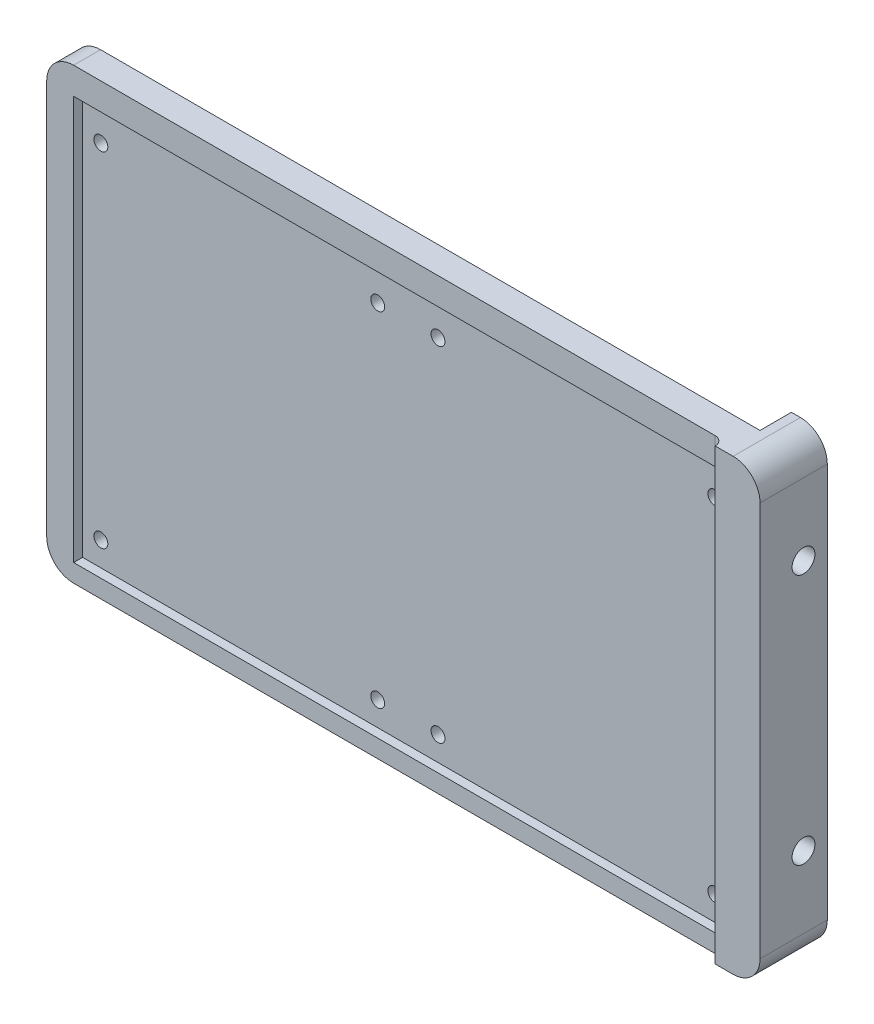
from build123d import *

# Parameters (mm, degrees)
SKETCH1_W                       = 5.3
SKETCH1_H                       = 76.6
SKETCH1_H_2                     = 9.4
SKETCH1_H_3                     = 14
BOSS_EXTRUDE1_DEPTH             = 4
BOSS_EXTRUDE2_DEPTH             = 100
BOSS_EXTRUDE3_REACH             = 186.786
BOSS_EXTRUDE3_DIRECTION_2_REACH = 186.786
FILLET1_R                       = 6
CHAMFER1_SIZE                   = 2
CUT_EXTRUDE1_START              = -4
CUT_EXTRUDE1_DEPTH              = 4
BOSS_EXTRUDE4_DEPTH             = 2
FILLET3_R                       = 2
CUT_EXTRUDE2_START              = -10
CUT_EXTRUDE2_DEPTH              = 10
FILLET4_R                       = 2
FILLET5_R                       = 2


# Some blends are built 0.0001 mm under size
with BuildPart() as part:
    # Sketch1 → Boss-Extrude1 (new body)
    with BuildSketch(Plane.XY):
        with BuildLine():
            Line((0, 100), (0, 0))
            Line((0, 0), (4.07, 0))
            Line((4.07, 0), (4.07, 7.85))
            ThreePointArc((4.07, 7.85), (2.52, 9.4), (4.07, 10.95))
            Line((4.07, 10.95), (4.07, 84.45))
            ThreePointArc((4.07, 84.45), (2.52, 86), (4.07, 87.55))
            Line((4.07, 87.55), (4.07, 100))
            Line((4.07, 100), (0, 100))
        make_face()
        with BuildLine():
            Line((65.78, 100), (4.07, 100))
            Line((4.07, 100), (4.07, 87.55))
            ThreePointArc((4.07, 87.55), (5.166015511, 87.096015511), (5.62, 86))
            Line((5.62, 86), (64.23, 86))
            ThreePointArc((64.23, 86), (64.683984489, 87.096015511), (65.78, 87.55))
            Line((65.78, 87.55), (65.78, 100))
        make_face()
        with BuildLine():
            Line((4.07, 84.45), (4.07, 10.95))
            ThreePointArc((4.07, 10.95), (5.166015511, 10.496015511), (5.62, 9.4))
            Line((5.62, 9.4), (64.23, 9.4))
            ThreePointArc((64.23, 9.4), (64.683984489, 10.496015511), (65.78, 10.95))
            Line((65.78, 10.95), (65.78, 84.45))
            ThreePointArc((65.78, 84.45), (64.683984489, 84.903984489), (64.23, 86))
            Line((64.23, 86), (5.62, 86))
            ThreePointArc((5.62, 86), (5.166015511, 84.903984489), (4.07, 84.45))
        make_face()
        with BuildLine():
            Line((4.07, 7.85), (4.07, 0))
            Line((4.07, 0), (65.78, 0))
            Line((65.78, 0), (65.78, 7.85))
            ThreePointArc((65.78, 7.85), (64.683984489, 8.303984489), (64.23, 9.4))
            Line((64.23, 9.4), (5.62, 9.4))
            ThreePointArc((5.62, 9.4), (5.166015511, 8.303984489), (4.07, 7.85))
        make_face()
        with BuildLine():
            Line((67.33, 9.4), (69.85, 9.4))
            Line((69.85, 9.4), (69.85, 86))
            Line((69.85, 86), (67.33, 86))
            ThreePointArc((67.33, 86), (66.876015511, 84.903984489), (65.78, 84.45))
            Line((65.78, 84.45), (65.78, 10.95))
            ThreePointArc((65.78, 10.95), (66.876015511, 10.496015511), (67.33, 9.4))
        make_face()
        with Locations((72.5, 47.7)):
            Rectangle(SKETCH1_W, SKETCH1_H)
        with BuildLine():
            Line((75.15, 86), (75.15, 9.4))
            Line((75.15, 9.4), (77.67, 9.4))
            ThreePointArc((77.67, 9.4), (78.123984489, 10.496015511), (79.22, 10.95))
            Line((79.22, 10.95), (79.22, 84.45))
            ThreePointArc((79.22, 84.45), (78.123984489, 84.903984489), (77.67, 86))
            Line((77.67, 86), (75.15, 86))
        make_face()
        with BuildLine():
            Line((65.78, 7.85), (65.78, 0))
            Line((65.78, 0), (69.85, 0))
            Line((69.85, 0), (69.85, 9.4))
            Line((69.85, 9.4), (67.33, 9.4))
            ThreePointArc((67.33, 9.4), (66.876015511, 8.303984489), (65.78, 7.85))
        make_face()
        with Locations((72.5, 4.7)):
            Rectangle(SKETCH1_W, SKETCH1_H_2)
        with BuildLine():
            Line((75.15, 9.4), (75.15, 0))
            Line((75.15, 0), (79.22, 0))
            Line((79.22, 0), (79.22, 7.85))
            ThreePointArc((79.22, 7.85), (78.123984489, 8.303984489), (77.67, 9.4))
            Line((77.67, 9.4), (75.15, 9.4))
        make_face()
        with BuildLine():
            Line((69.85, 100), (65.78, 100))
            Line((65.78, 100), (65.78, 87.55))
            ThreePointArc((65.78, 87.55), (66.876015511, 87.096015511), (67.33, 86))
            Line((67.33, 86), (69.85, 86))
            Line((69.85, 86), (69.85, 100))
        make_face()
        with Locations((72.5, 93)):
            Rectangle(SKETCH1_W, SKETCH1_H_3)
        with BuildLine():
            Line((79.22, 100), (75.15, 100))
            Line((75.15, 100), (75.15, 86))
            Line((75.15, 86), (77.67, 86))
            ThreePointArc((77.67, 86), (78.123984489, 87.096015511), (79.22, 87.55))
            Line((79.22, 87.55), (79.22, 100))
        make_face()
        with BuildLine():
            Line((140.93, 100), (79.22, 100))
            Line((79.22, 100), (79.22, 87.55))
            ThreePointArc((79.22, 87.55), (80.316015511, 87.096015511), (80.77, 86))
            Line((80.77, 86), (139.38, 86))
            ThreePointArc((139.38, 86), (139.833984489, 87.096015511), (140.93, 87.55))
            Line((140.93, 87.55), (140.93, 100))
        make_face()
        with BuildLine():
            ThreePointArc((79.22, 10.95), (80.316015511, 10.496015511), (80.77, 9.4))
            Line((80.77, 9.4), (139.38, 9.4))
            ThreePointArc((139.38, 9.4), (139.833984489, 10.496015511), (140.93, 10.95))
            Line((140.93, 10.95), (140.93, 84.45))
            ThreePointArc((140.93, 84.45), (139.833984489, 84.903984489), (139.38, 86))
            Line((139.38, 86), (80.77, 86))
            ThreePointArc((80.77, 86), (80.316015511, 84.903984489), (79.22, 84.45))
            Line((79.22, 84.45), (79.22, 10.95))
        make_face()
        with BuildLine():
            Line((140.93, 7.85), (140.93, 0))
            Line((140.93, 0), (145, 0))
            Line((145, 0), (145, 100))
            Line((145, 100), (140.93, 100))
            Line((140.93, 100), (140.93, 87.55))
            ThreePointArc((140.93, 87.55), (142.026015511, 87.096015511), (142.48, 86))
            ThreePointArc((142.48, 86), (142.026015511, 84.903984489), (140.93, 84.45))
            Line((140.93, 84.45), (140.93, 10.95))
            ThreePointArc((140.93, 10.95), (142.026015511, 10.496015511), (142.48, 9.4))
            ThreePointArc((142.48, 9.4), (142.026015511, 8.303984489), (140.93, 7.85))
        make_face()
        with BuildLine():
            Line((79.22, 7.85), (79.22, 0))
            Line((79.22, 0), (140.93, 0))
            Line((140.93, 0), (140.93, 7.85))
            ThreePointArc((140.93, 7.85), (139.833984489, 8.303984489), (139.38, 9.4))
            Line((139.38, 9.4), (80.77, 9.4))
            ThreePointArc((80.77, 9.4), (80.316015511, 8.303984489), (79.22, 7.85))
        make_face()
    extrude(amount=BOSS_EXTRUDE1_DEPTH)

    # Sketch2 → Boss-Extrude2 (add)
    with BuildSketch(Plane(origin=(0, 100, 0), x_dir=(1, 0, 0), z_dir=(0, 1, 0))):
        Polygon((145, 7), (145, 0), (145, -4), (145, -10), (155, -10), (155, 7), align=None)
    extrude(amount=-BOSS_EXTRUDE2_DEPTH)

    # Boss-Extrude3: up to this face of the body (flat: up to its plane)
    boss_extrude3_end = Plane(part.part.faces().sort_by_distance((150, 50, 10))[0])
    # Sketch3 → Boss-Extrude3 (add, up to the picked face)
    with BuildSketch(Plane.XY.offset(4), mode=Mode.PRIVATE) as boss_extrude3_sk1:
        Polygon((145, 100), (145, 94), (0, 94), (0, 4), (145, 4), (145, 0), (0, 0), (-6, 0), (-6, 100), align=None)
    boss_extrude3_tool1 = split(extrude(boss_extrude3_sk1.sketch, amount=BOSS_EXTRUDE3_REACH, mode=Mode.PRIVATE), bisect_by=boss_extrude3_end, keep=Keep.BOTH, mode=Mode.PRIVATE)
    add(boss_extrude3_tool1.solids().sort_by(Axis((143.188895, 97, 4), (0, 0, 1)))[0])

    # Boss-Extrude3 direction 2: up to this face of the body (flat: up to its plane)
    boss_extrude3_direction_2_end = Plane(part.part.faces().sort_by_distance((72.5, 50.009617792, 0))[0])
    # Sketch3 → Boss-Extrude3 direction 2 (add, up to the picked face)
    with BuildSketch(Plane.XY.offset(4), mode=Mode.PRIVATE) as boss_extrude3_direction_2_sk1:
        Polygon((145, 100), (145, 94), (0, 94), (0, 4), (145, 4), (145, 0), (0, 0), (-6, 0), (-6, 100), align=None)
    boss_extrude3_direction_2_tool1 = split(extrude(boss_extrude3_direction_2_sk1.sketch, amount=-BOSS_EXTRUDE3_DIRECTION_2_REACH, mode=Mode.PRIVATE), bisect_by=boss_extrude3_direction_2_end, keep=Keep.BOTH, mode=Mode.PRIVATE)
    add(boss_extrude3_direction_2_tool1.solids().sort_by(Axis((143.188895, 97, 4), (0, 0, -1)))[0])

    # Fillet1
    fillet1_edges = [part.edges().sort_by_distance(p)[0] for p in [
        (155, 100, 1.5),
        (155, 0, 1.5),
        (-6, 0, 5),
        (-6, 100, 5),
    ]]
    fillet(fillet1_edges, radius=FILLET1_R)

    # Chamfer1
    chamfer1_edges = [part.edges().sort_by_distance(p)[0] for p in [
        (145, 0, -3.5),
        (145, 100, -3.5),
    ]]
    chamfer(chamfer1_edges, length=CHAMFER1_SIZE)

    # Sketch4 → Cut-Extrude1 (cut)
    with BuildSketch(Plane.XY.offset(10).offset(CUT_EXTRUDE1_START)):
        with BuildLine():
            Line((-6, 94), (-6, 6))
            ThreePointArc((-6, 6), (-4.242640687, 1.757359313), (0, 0))
            Line((0, 0), (149, 0))
            ThreePointArc((149, 0), (153.242640687, 1.757359313), (155, 6))
            Line((155, 6), (155, 94))
            ThreePointArc((155, 94), (153.242640687, 98.242640687), (149, 100))
            Line((149, 100), (0, 100))
            ThreePointArc((0, 100), (-4.242640687, 98.242640687), (-6, 94))
        make_face()
    extrude(amount=CUT_EXTRUDE1_DEPTH, mode=Mode.SUBTRACT)

    # Sketch5 → Boss-Extrude4 (add)
    with BuildSketch(Plane.XY.offset(6)):
        with BuildLine():
            Line((145, 100), (145, 94))
            Line((145, 94), (145, 4))
            Line((145, 4), (145, 0))
            Line((145, 0), (149, 0))
            ThreePointArc((149, 0), (153.242640687, 1.757359313), (155, 6))
            Line((155, 6), (155, 94))
            ThreePointArc((155, 94), (153.242640687, 98.242640687), (149, 100))
            Line((149, 100), (145, 100))
        make_face()
    extrude(amount=BOSS_EXTRUDE4_DEPTH)

    # Fillet3
    fillet3_edges = [part.edges().sort_by_distance(p)[0] for p in [
        (145, 2, 6),
        (145, 97, 6),
    ]]
    fillet(fillet3_edges, radius=FILLET3_R - 0.0001)  # a hair under: the kernel refuses the full size

    # Sketch6 → Cut-Extrude2 (cut)
    with BuildSketch(Plane(origin=(155, 0, 0), x_dir=(0, 0, -1), z_dir=(1, 0, 0)).offset(CUT_EXTRUDE2_START)):
        with BuildLine():
            ThreePointArc((4.25, 78), (3.503122292, 79.803122292), (1.7, 80.55))
            Line((1.7, 80.55), (1.7, 78))
            Line((1.7, 78), (1.7, 75.45))
            ThreePointArc((1.7, 75.45), (3.503122292, 76.196877708), (4.25, 78))
        make_face()
        with BuildLine():
            Line((1.7, 78), (1.7, 80.55))
            ThreePointArc((1.7, 80.55), (-0.85, 78), (1.7, 75.45))
            Line((1.7, 75.45), (1.7, 78))
        make_face()
        with BuildLine():
            ThreePointArc((4.25, 22), (3.503122292, 23.803122292), (1.7, 24.55))
            Line((1.7, 24.55), (1.7, 22))
            Line((1.7, 22), (1.7, 19.45))
            ThreePointArc((1.7, 19.45), (3.503122292, 20.196877708), (4.25, 22))
        make_face()
        with BuildLine():
            Line((1.7, 22), (1.7, 24.55))
            ThreePointArc((1.7, 24.55), (-0.85, 22), (1.7, 19.45))
            Line((1.7, 19.45), (1.7, 22))
        make_face()
    extrude(amount=CUT_EXTRUDE2_DEPTH, mode=Mode.SUBTRACT)

    # Fillet4
    # the kernel refuses this fillet: 2 mm, written as the material it takes off along each edge
    with BuildSketch(Plane(origin=(145, 15.099342219, 0), x_dir=(-1, 0, 0), z_dir=(0, 1, 0))) as fillet4_piece_1_section:
        with BuildLine():
            CenterArc((FILLET4_R, FILLET4_R), FILLET4_R, 180, 90)
            Line((0, FILLET4_R), (0, 0))
            Line((0, 0), (FILLET4_R, 0))
        make_face()
    fillet4_piece_1 = extrude(amount=13.801315562, mode=Mode.PRIVATE)
    fillet4_piece_1 = fillet4_piece_1 & Plane(origin=(144.444640092, 22, -1.7), x_dir=(0, -1, 0), z_dir=(-1, 0, 0)) * Cylinder(2.55, 36, mode=Mode.PRIVATE)
    add(fillet4_piece_1, mode=Mode.SUBTRACT)
    with BuildSketch(Plane(origin=(145, 71.099342219, 0), x_dir=(-1, 0, 0), z_dir=(0, 1, 0))) as fillet4_piece_2_section:
        with BuildLine():
            CenterArc((FILLET4_R, FILLET4_R), FILLET4_R, 180, 90)
            Line((0, FILLET4_R), (0, 0))
            Line((0, 0), (FILLET4_R, 0))
        make_face()
    fillet4_piece_2 = extrude(amount=13.801315562, mode=Mode.PRIVATE)
    fillet4_piece_2 = fillet4_piece_2 & Plane(origin=(144.444640092, 78, -1.7), x_dir=(0, -1, 0), z_dir=(-1, 0, 0)) * Cylinder(2.55, 36, mode=Mode.PRIVATE)
    add(fillet4_piece_2, mode=Mode.SUBTRACT)

    # Fillet5
    fillet5_edges = [part.edges().sort_by_distance(p)[0] for p in [
        (144, 76.099342219, 0),
        (144, 79.900657781, 0),
        (144, 20.099342219, 0),
        (144, 23.900657781, 0),
    ]]
    fillet(fillet5_edges, radius=FILLET5_R)


solid = part.part
